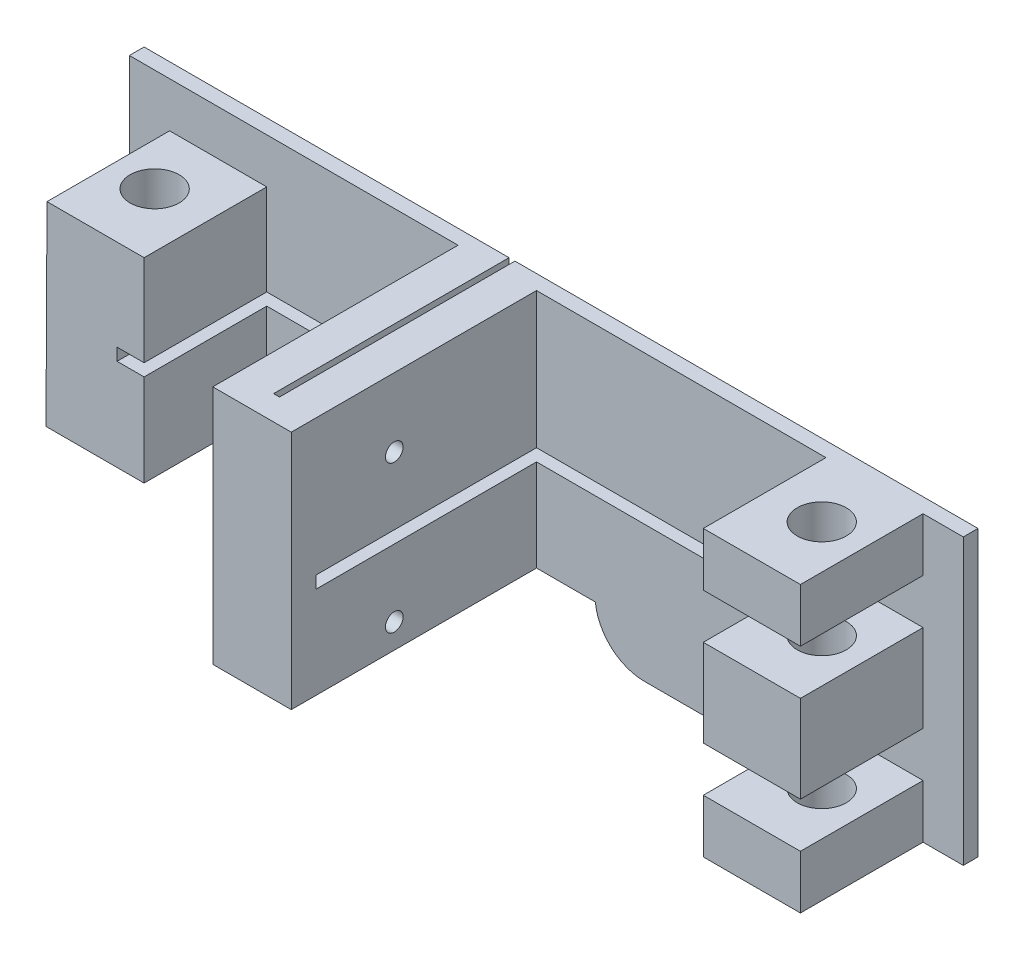
from build123d import *

# Parameters (mm, degrees)
SKETCH1_W           = 170
SKETCH1_H           = 58
BOSS_EXTRUDE1_DEPTH = 5
SKETCH2_W           = 28
SKETCH2_H           = 58
BOSS_EXTRUDE2_DEPTH = 25
CUT_EXTRUDE4_DEPTH  = 25
SKETCH6_W           = 16
SKETCH6_H           = 58
BOSS_EXTRUDE3_DEPTH = 50
SKETCH7_W           = 1.2
SKETCH7_H           = 58
CUT_EXTRUDE5_DEPTH  = 50
CUT_EXTRUDE6_DEPTH  = 50
SKETCH9_R           = 1.8
CUT_EXTRUDE7_DEPTH  = 20
HOLE3_START         = -20
HOLE3_OUTLINE_R     = 5
HOLE3_DEPTH         = 39.8
HOLE4_START         = -29
HOLE4_OUTLINE_R     = 5
HOLE4_DEPTH         = 58
SKETCH12_W          = 40
SKETCH12_H          = 9
CUT_EXTRUDE8_DEPTH  = 106.313816757
FILLET1_R           = 10
CHAMFER1_SIZE       = 2


# Read off the part's stored shape, not the designer's step: Hole3, Hole4
with BuildPart() as part:
    # Sketch1 → Boss-Extrude1 (new body)
    with BuildSketch(Plane.XY):
        Rectangle(SKETCH1_W, SKETCH1_H)
    extrude(amount=BOSS_EXTRUDE1_DEPTH)

    # Sketch2 → Boss-Extrude2 (add)
    with BuildSketch(Plane(origin=(0, 0, 5), x_dir=(-1, 0, 0), z_dir=(0, 0, -1))):
        with Locations((71, 0)):
            Rectangle(SKETCH2_W, SKETCH2_H)
        with Locations((-71, 0)):
            Rectangle(SKETCH2_W, SKETCH2_H)
    extrude(amount=-BOSS_EXTRUDE2_DEPTH)

    # Sketch3 → Cut-Extrude4 (cut)
    with BuildSketch(Plane.XY.offset(30)):
        Polygon((-57, -29), (-57, -20), (-77, -20), (-76.8, 19.8), (-57, 19.8), (-57, 29), (-85, 29), (-85, -29), align=None)
        Polygon((56, 8.9), (56, 18.1), (76.8, 18.1), (76.8, 29), (85, 29), (85, -29), (76.8, -29), (76.8, -18.1), (56, -18.1), (56, -8.9), (76.8, -8.9), (76.8, 8.9), align=None)
    extrude(amount=-CUT_EXTRUDE4_DEPTH, mode=Mode.SUBTRACT)

    # Sketch6 → Boss-Extrude3 (add)
    with BuildSketch(Plane.XY.offset(5)):
        with Locations((-10, 0)):
            Rectangle(SKETCH6_W, SKETCH6_H)
    extrude(amount=BOSS_EXTRUDE3_DEPTH)

    # Sketch7 → Cut-Extrude5 (cut)
    with BuildSketch(Plane(origin=(0, 0, 0), x_dir=(-1, 0, 0), z_dir=(0, 0, -1))):
        with Locations((10, 0)):
            Rectangle(SKETCH7_W, SKETCH7_H)
    extrude(amount=-CUT_EXTRUDE5_DEPTH, mode=Mode.SUBTRACT)

    # Sketch8 → Cut-Extrude6 (cut)
    with BuildSketch(Plane(origin=(0, 0, 0), x_dir=(-1, 0, 0), z_dir=(0, 0, -1))):
        with BuildLine():
            Line((15.356071321, 1.25), (62.5, 1.25))
            Line((62.5, 1.25), (62.5, -1.25))
            Line((62.5, -1.25), (15.356071321, -1.25))
            ThreePointArc((15.356071321, -1.25), (10, -5.5), (4.643928679, -1.25))
            Line((4.643928679, -1.25), (-42.5, -1.25))
            Line((-42.5, -1.25), (-42.5, 1.25))
            Line((-42.5, 1.25), (4.643928679, 1.25))
            ThreePointArc((4.643928679, 1.25), (10, 5.5), (15.356071321, 1.25))
        make_face()
    extrude(amount=-CUT_EXTRUDE6_DEPTH, mode=Mode.SUBTRACT)

    # Sketch9 → Cut-Extrude7 (cut)
    with BuildSketch(Plane.ZY.offset(18)):
        with Locations((34, 15)):
            Circle(SKETCH9_R)
        with Locations((34, -15)):
            Circle(SKETCH9_R)
    extrude(amount=-CUT_EXTRUDE7_DEPTH, mode=Mode.SUBTRACT)

    # Hole3 outline → Hole3 (cut)
    with BuildSketch(Plane(origin=(0, 0, 0), x_dir=(1, 0, 0), z_dir=(0, 1, 0)).offset(HOLE3_START)):
        with Locations((-68.081865543, -16.770132162)):
            Circle(HOLE3_OUTLINE_R)
    extrude(amount=HOLE3_DEPTH, mode=Mode.SUBTRACT)

    # Hole4 outline → Hole4 (cut)
    with BuildSketch(Plane(origin=(0, 0, 0), x_dir=(1, 0, 0), z_dir=(0, 1, 0)).offset(HOLE4_START)):
        with Locations((67.918134457, -16.770132162)):
            Circle(HOLE4_OUTLINE_R)
    extrude(amount=HOLE4_DEPTH, mode=Mode.SUBTRACT)

    # Sketch12 → Cut-Extrude8 (cut, through all)
    with BuildSketch(Plane(origin=(0, 0, 0), x_dir=(-1, 0, 0), z_dir=(0, 0, -1))):
        with Locations((10, -24.5)):
            Rectangle(SKETCH12_W, SKETCH12_H)
    extrude(amount=-CUT_EXTRUDE8_DEPTH, mode=Mode.SUBTRACT)

    # Fillet1
    # the kernel refuses this fillet: 10 mm, written as the material it takes off along each edge
    with BuildSketch(Plane(origin=(-30, -29, -24.874685928), x_dir=(0, 1, 0), z_dir=(0, 0, 1))) as fillet1_piece_1:
        with BuildLine():
            CenterArc((10, 9.949874371), FILLET1_R, 180, 84.260829523)
            Line((0, 9.949874371), (-0.2, 9.949874371))
            Line((-0.2, 9.949874371), (-0.2, 0))
            Line((-0.2, 0), (0, -0.2))
            ThreePointArc((0, -0.2), (4.5, -0.2), (8.98, -0.198997487))
            Line((8.98, -0.198997487), (9, 0))
        make_face()
    extrude(amount=54.749371855, mode=Mode.SUBTRACT)
    with BuildSketch(Plane(origin=(10, -29, -24.874685928), x_dir=(0, 1, 0), z_dir=(0, 0, 1))) as fillet1_piece_2:
        with BuildLine():
            CenterArc((10, -9.949874371), FILLET1_R, 95.739170477, 84.260829523)
            Line((0, -9.949874371), (-0.2, -9.949874371))
            Line((-0.2, -9.949874371), (-0.2, 0))
            Line((-0.2, 0), (0, 0.2))
            ThreePointArc((0, 0.2), (4.5, 0.2), (8.98, 0.198997487))
            Line((8.98, 0.198997487), (9, 0))
        make_face()
    extrude(amount=54.749371855, mode=Mode.SUBTRACT)

    # Chamfer1
    chamfer1_edges = [part.edges().sort_by_distance(p)[0] for p in [
        (-47.8, 29, 0),
        (-9.4, 17.233587387, 0),
        (-10.6, 17.233587387, 0),
        (-9.4, -12.733587387, 0),
        (-6.351049855, -4.115235453, 0),
        (-6.351049855, 4.115235453, 0),
        (18.928035661, 1.25, 0),
        (42.5, 0, 0),
        (18.928035661, -1.25, 0),
        (-13.648950145, 4.115235453, 0),
        (-13.648950145, -4.115235453, 0),
        (-38.928035661, -1.25, 0),
        (-62.5, 0, 0),
        (-38.928035661, 1.25, 0),
        (-10.6, -12.733587387, 0),
        (0.3, -20, 0),
        (-20.3, -20, 0),
        (-33.241670439, -26.416198487, 0),
        (52.474937186, -29, 0),
        (13.241670439, -26.416198487, 0),
        (37.8, 29, 0),
        (85, 0, 0),
        (-62.474937186, -29, 0),
        (-85, 0, 0),
    ]]
    chamfer(chamfer1_edges, length=CHAMFER1_SIZE)


solid = part.part
